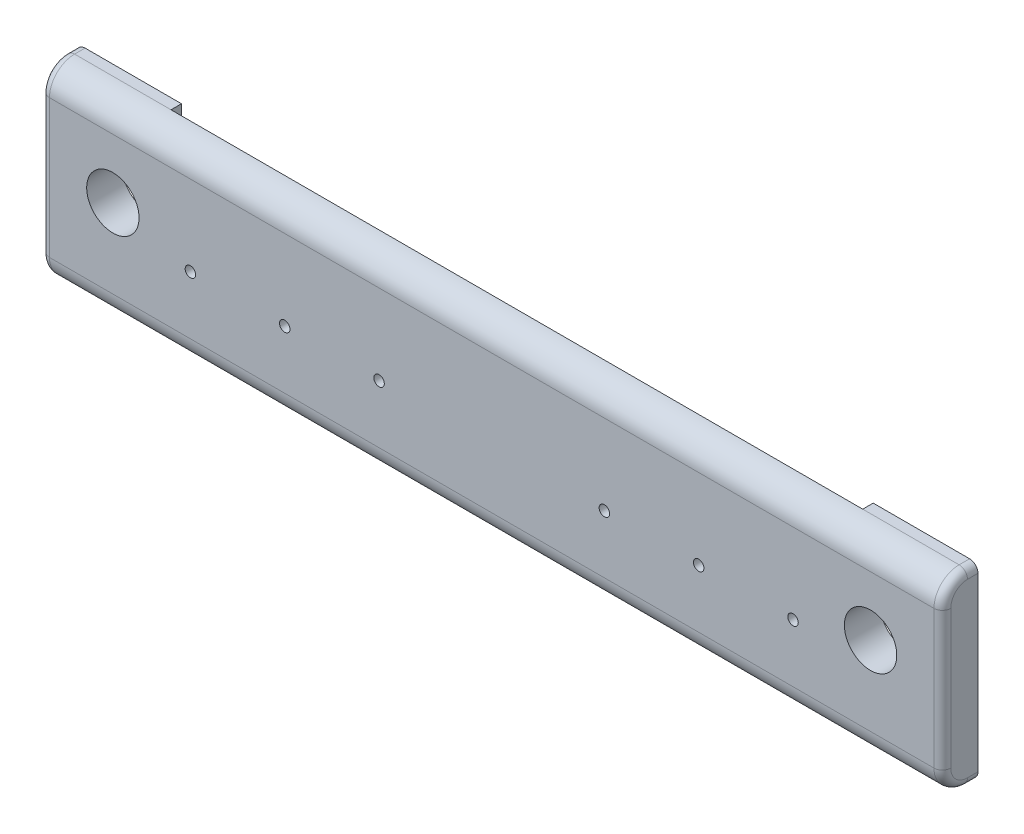
from build123d import *

# Parameters (mm, degrees)
ESBO_O1_W                = 43
ESBO_O1_H                = 9
RESSALTO_EXTRUS_O1_DEPTH = 1.2
ESBO_O4_W                = 5
ESBO_O4_H                = 9
RESSALTO_EXTRUS_O4_DEPTH = 0.5
FILETE1_R                = 1.2
FILETE2_R                = 1.2
ESBO_O6_R                = 1.25
CORTE_EXTRUS_O2_DEPTH    = 5.5
FILETE3_R                = 0.4
FILETE4_R                = 0.4
ESBO_O7_R                = 0.25
CORTE_EXTRUS_O3_DEPTH    = 23.031568281


with BuildPart() as part:
    # Esboço1 → Ressalto-extrusão1 (new body)
    with BuildSketch(Plane.XY):
        Rectangle(ESBO_O1_W, ESBO_O1_H)
    extrude(amount=RESSALTO_EXTRUS_O1_DEPTH)

    # Esboço4 → Ressalto-extrusão4 (add)
    with BuildSketch(Plane(origin=(0, 0, 0), x_dir=(-1, 0, 0), z_dir=(0, 0, -1))):
        with Locations((19, 0)):
            Rectangle(ESBO_O4_W, ESBO_O4_H)
        with Locations((-19, 0)):
            Rectangle(ESBO_O4_W, ESBO_O4_H)
    extrude(amount=RESSALTO_EXTRUS_O4_DEPTH)

    # Filete1
    filete1_edges = [part.edges().sort_by_distance(p)[0] for p in [
        (0, 4.5, 1.2),
    ]]
    fillet(filete1_edges, radius=FILETE1_R - 0.0001)  # a hair under: the kernel refuses the full size

    # Filete2
    filete2_edges = [part.edges().sort_by_distance(p)[0] for p in [
        (0, -4.5, 1.2),
    ]]
    fillet(filete2_edges, radius=FILETE2_R - 0.0001)  # a hair under: the kernel refuses the full size

    # Esboço6 → Corte-extrusão2 (cut)
    with BuildSketch(Plane(origin=(0, 0, -0.5), x_dir=(-1, 0, 0), z_dir=(0, 0, -1))):
        with Locations((-18.075, 0.470186795)):
            Circle(ESBO_O6_R)
        with Locations((18.075, 0.470186795)):
            Circle(ESBO_O6_R)
    extrude(amount=-CORTE_EXTRUS_O2_DEPTH, mode=Mode.SUBTRACT)

    # Filete3
    filete3_edges = [part.edges().sort_by_distance(p)[0] for p in [
        (-21.5, 0, 1.2),
        (-21.5, 4.5, -0.24995),
        (-21.5, 4.148557427, 0.848557427),
        (-21.5, -4.5, -0.24995),
        (-21.5, -4.148557427, 0.848557427),
    ]]
    fillet(filete3_edges, radius=FILETE3_R)

    # Filete4
    filete4_edges = [part.edges().sort_by_distance(p)[0] for p in [
        (21.5, 4.5, -0.24995),
        (21.5, 4.148557427, 0.848557427),
        (21.5, 0, 1.2),
        (21.5, -4.5, -0.24995),
        (21.5, -4.148557427, 0.848557427),
    ]]
    fillet(filete4_edges, radius=FILETE4_R)

    # Esboço7 → Corte-extrusão3 (cut, through all)
    with BuildSketch(Plane.XY.offset(1.2)):
        with Locations((14.375, -0.529813205)):
            Circle(ESBO_O7_R)
        with Locations((-14.375, -0.529813205)):
            Circle(ESBO_O7_R)
        with Locations((-9.875, -0.529813205)):
            Circle(ESBO_O7_R)
        with Locations((-5.375, -0.529813205)):
            Circle(ESBO_O7_R)
        with Locations((9.875, -0.529813205)):
            Circle(ESBO_O7_R)
        with Locations((5.375, -0.529813205)):
            Circle(ESBO_O7_R)
    extrude(amount=-CORTE_EXTRUS_O3_DEPTH, mode=Mode.SUBTRACT)


solid = part.part
